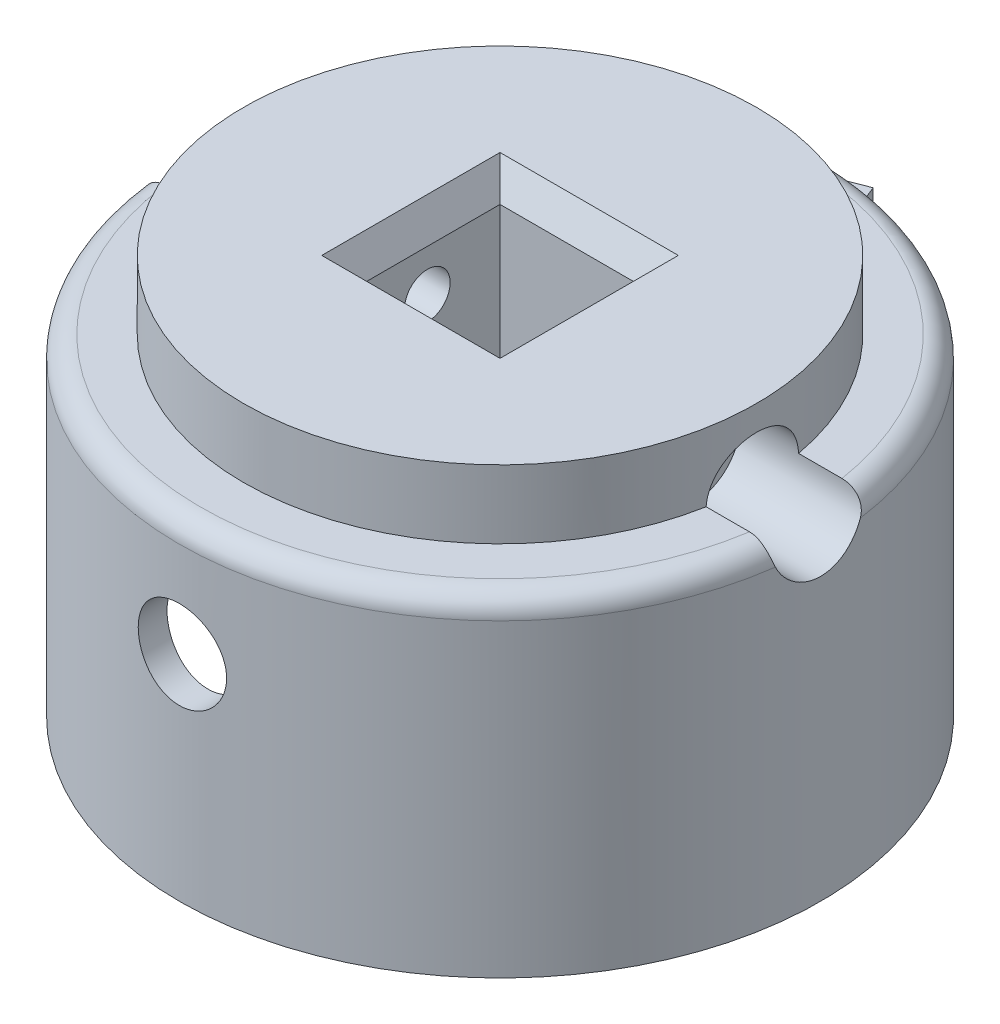
from build123d import *
from OCP.BRepFilletAPI import BRepFilletAPI_MakeChamfer

# Parameters (mm, degrees)
SKETCH1_R                = 22.5
BOSS_EXTRUDE1_DEPTH      = 28
SKETCH2_W                = 10.2
SKETCH2_H                = 10.2
CUT_EXTRUDE2_DEPTH       = 43.385138905
SHELL3_T                 = -2
SKETCH3_R                = 3.1
CUT_EXTRUDE3_DEPTH       = 47.544709689
CHAMFER1_SIZE            = 2
CHAMFER1_SIZE2           = 1.154700538
BOSS_EXTRUDE8_START      = 23
BOSS_EXTRUDE8_DEPTH      = 23
BOSS_EXTRUDE4_DEPTH      = 20
BOSS_EXTRUDE6_DEPTH      = 26
CUT_EXTRUDE5_DEPTH       = 12
SKETCH13_R               = 3.8
CUT_EXTRUDE6_DEPTH       = 16
SKETCH15_W               = 10
SKETCH15_H               = 3
CUT_EXTRUDE8_DEPTH       = 16
CUT_EXTRUDE9_DEPTH       = 2
BOSS_EXTRUDE10_START     = 7
BOSS_EXTRUDE10_DEPTH     = 7
SKETCH21_OUTSIDE_W       = 61.262
SKETCH21_OUTSIDE_H       = 63.966
SKETCH21_OUTSIDE_R       = 18
CUT_EXTRUDE11_DEPTH      = 4.8
CUT_EXTRUDE12_DEPTH      = 47.700948218
CUT_EXTRUDE12_DEPTH_BACK = 47.700948218
SKETCH22_R               = 1.6
CUT_EXTRUDE13_START      = -8.5
SKETCH24_R               = 3.25
CUT_EXTRUDE13_DEPTH      = 39.200948278
CUT_EXTRUDE14_START      = -8.5
CUT_EXTRUDE14_DEPTH      = 39.200948279
FILLET1_R                = 1.5


with BuildPart() as part:
    # Sketch1 → Boss-Extrude1 (new body)
    with BuildSketch(Plane(origin=(0, 0, 0), x_dir=(1, 0, 0), z_dir=(0, 1, 0))):
        with Locations(Location((0, 0, 0), (0, 0, 270))):
            Circle(SKETCH1_R)
    extrude(amount=BOSS_EXTRUDE1_DEPTH)

    # Sketch2 → Cut-Extrude2 (cut, through all)
    with BuildSketch(Plane.XZ):
        Rectangle(SKETCH2_W, SKETCH2_H)
    extrude(amount=-CUT_EXTRUDE2_DEPTH, mode=Mode.SUBTRACT)

    # Shell3
    shell3_openings = [part.faces().sort_by_distance(p)[0] for p in [
        (0, 0, -21.863603897),
    ]]
    offset(amount=SHELL3_T, openings=shell3_openings, kind=Kind.INTERSECTION)

    # Sketch3 → Cut-Extrude3 (cut, through all)
    with BuildSketch(Plane.XY.offset(7.1)):
        with Locations(Location((0, 15, 0), (0, 0, 270.000000016))):
            Circle(SKETCH3_R)
    extrude(amount=CUT_EXTRUDE3_DEPTH, mode=Mode.SUBTRACT)

    # Chamfer1: one chamfer whose edges measure the first distance from different faces: ONE call of the kernel's chamfer builder (chamfer() names one face for all edges)
    chamfer1_edges_1 = [part.edges().sort_by_distance(p)[0] for p in [
        (5.1, 28, 0),
    ]]
    chamfer1_side_1 = [part.faces().sort_by_distance(p)[0] for p in [
        (5.1, 14, 0),
    ]]
    chamfer1_edges_2 = [part.edges().sort_by_distance(p)[0] for p in [
        (0, 28, -5.1),
    ]]
    chamfer1_side_2 = [part.faces().sort_by_distance(p)[0] for p in [
        (0, 14, -5.1),
    ]]
    chamfer1_edges_3 = [part.edges().sort_by_distance(p)[0] for p in [
        (-5.1, 28, 0),
    ]]
    chamfer1_side_3 = [part.faces().sort_by_distance(p)[0] for p in [
        (-5.1, 14, 0),
    ]]
    chamfer1_edges_4 = [part.edges().sort_by_distance(p)[0] for p in [
        (0, 28, 5.1),
    ]]
    chamfer1_side_4 = [part.faces().sort_by_distance(p)[0] for p in [
        (0, 14, 5.1),
    ]]
    chamfer1 = BRepFilletAPI_MakeChamfer(part.part.solid().wrapped)
    for e in chamfer1_edges_1:
        chamfer1.Add(CHAMFER1_SIZE, CHAMFER1_SIZE2, e.wrapped, chamfer1_side_1[0].wrapped)  # the first distance lies on this face
    for e in chamfer1_edges_2:
        chamfer1.Add(CHAMFER1_SIZE, CHAMFER1_SIZE2, e.wrapped, chamfer1_side_2[0].wrapped)  # the first distance lies on this face
    for e in chamfer1_edges_3:
        chamfer1.Add(CHAMFER1_SIZE, CHAMFER1_SIZE2, e.wrapped, chamfer1_side_3[0].wrapped)  # the first distance lies on this face
    for e in chamfer1_edges_4:
        chamfer1.Add(CHAMFER1_SIZE, CHAMFER1_SIZE2, e.wrapped, chamfer1_side_4[0].wrapped)  # the first distance lies on this face
    add(Compound.cast(chamfer1.Shape()), mode=Mode.REPLACE)

    # Sketch18 → Boss-Extrude8 (add)
    with BuildSketch(Plane.XZ.offset(-26).offset(BOSS_EXTRUDE8_START)):
        with BuildLine():
            Line((-15.72889581, -7.671495069), (-18.425277949, -8.986608509))
            ThreePointArc((-18.425277949, -8.986608509), (-20.471905462, 1.072887103), (-17.384985971, 10.863344917))
            Line((-17.384985971, 10.863344917), (-14.840841683, 9.273587124))
            ThreePointArc((-14.840841683, 9.273587124), (-17.476016858, 0.915879234), (-15.72889581, -7.671495069))
        make_face()
    extrude(amount=-BOSS_EXTRUDE8_DEPTH)

    # Sketch9 → Boss-Extrude4 (add)
    with BuildSketch(Plane.XZ):
        Polygon((2.063720939, -22.405156904), (-16.592183615, -15.197020856), (-17.673404022, -17.995406539), (0.982500531, -25.203542587), align=None)
    extrude(amount=-BOSS_EXTRUDE4_DEPTH)

    # Sketch11 → Boss-Extrude6 (add)
    with BuildSketch(Plane.XZ):
        with BuildLine():
            Line((2.063720939, -22.405156904), (7.1, -7.1))
            Line((7.1, -7.1), (-7.1, -7.1))
            Line((-7.1, -7.1), (-16.592183615, -15.197020856))
            ThreePointArc((-16.592183615, -15.197020856), (-8.109153054, -20.987892623), (2.063720939, -22.405156904))
        make_face()
    extrude(amount=-BOSS_EXTRUDE6_DEPTH)

    # Sketch12 → Cut-Extrude5 (cut)
    with BuildSketch(Plane.XZ):
        with BuildLine():
            Line((3.815443281, -17.081705805), (2.751672557, -20.314484934))
            ThreePointArc((2.751672557, -20.314484934), (-6.944400642, -19.287957376), (-15.069534012, -13.89817055))
            Line((-15.069534012, -13.89817055), (-12.787120795, -11.951226815))
            ThreePointArc((-12.787120795, -11.951226815), (-5.167514201, -16.722412434), (3.815443281, -17.081705805))
        make_face()
    extrude(amount=-CUT_EXTRUDE5_DEPTH, mode=Mode.SUBTRACT)

    # Sketch13 → Cut-Extrude6 (cut)
    with BuildSketch(Plane(origin=(-8.345451745, 0, -21.599474563), x_dir=(-0.9327952276785314, 0, 0.3604068024054997), z_dir=(-0.3604068024054997, 0, -0.9327952276785314))):
        with Locations((0, 10)):
            Circle(SKETCH13_R)
    extrude(amount=-CUT_EXTRUDE6_DEPTH, mode=Mode.SUBTRACT)

    # Sketch15 → Cut-Extrude8 (cut)
    with BuildSketch(Plane(origin=(-8.345451745, 0, -21.599474563), x_dir=(-0.9327952276785314, 0, 0.3604068024054997), z_dir=(-0.3604068024054997, 0, -0.9327952276785314))):
        with Locations((0, 10)):
            Rectangle(SKETCH15_W, SKETCH15_H)
    extrude(amount=-CUT_EXTRUDE8_DEPTH, mode=Mode.SUBTRACT)

    # Sketch17 → Cut-Extrude9 (cut)
    with BuildSketch(Plane.XZ):
        with BuildLine():
            Line((7.1, 7.1), (7.1, -7.1))
            Line((7.1, -7.1), (3.815443281, -17.081705805))
            ThreePointArc((3.815443281, -17.081705805), (-5.167514201, -16.722412434), (-12.787120795, -11.951226815))
            Line((-12.787120795, -11.951226815), (-7.1, -7.1))
            Line((-7.1, -7.1), (-7.1, 7.1))
            Line((-7.1, 7.1), (7.1, 7.1))
        make_face()
    extrude(amount=-CUT_EXTRUDE9_DEPTH, mode=Mode.SUBTRACT)

    # Sketch20 → Boss-Extrude10 (add)
    with BuildSketch(Plane.XZ.offset(-26).offset(BOSS_EXTRUDE10_START)):
        with BuildLine():
            Line((2.751672557, -20.314484934), (7.1, -7.1))
            Line((7.1, -7.1), (7.1, 7.1))
            Line((7.1, 7.1), (-7.1, 7.1))
            Line((-7.1, 7.1), (-7.1, -7.1))
            Line((-7.1, -7.1), (-15.069534012, -13.89817055))
            ThreePointArc((-15.069534012, -13.89817055), (6.944400642, 19.287957376), (2.751672557, -20.314484934))
        make_face()
    extrude(amount=-BOSS_EXTRUDE10_DEPTH)

    # Sketch21 outside → Cut-Extrude11 (cut)
    with BuildSketch(Plane(origin=(0, 28, 0), x_dir=(1, 0, 0), z_dir=(0, 1, 0))):
        with Locations((0, 1.352)):
            Rectangle(SKETCH21_OUTSIDE_W, SKETCH21_OUTSIDE_H)
        with Locations(Location((0, 0, 0), (0, 0, 270))):
            Circle(SKETCH21_OUTSIDE_R, mode=Mode.SUBTRACT)
    extrude(amount=-CUT_EXTRUDE11_DEPTH, mode=Mode.SUBTRACT)

    # Sketch22 → Cut-Extrude12 (cut, two sides: drawn at the far end of the back side and taken through both)
    with BuildSketch(Plane.ZY.offset(-5.1).offset(-CUT_EXTRUDE12_DEPTH_BACK)):
        with Locations((0, 23)):
            Circle(SKETCH22_R)
    extrude(amount=CUT_EXTRUDE12_DEPTH + CUT_EXTRUDE12_DEPTH_BACK, mode=Mode.SUBTRACT)

    # Sketch24 → Cut-Extrude13 (cut, through all)
    with BuildSketch(Plane.ZY.offset(-5.1).offset(CUT_EXTRUDE13_START)):
        with Locations((0, 23)):
            Circle(SKETCH24_R)
    extrude(amount=-CUT_EXTRUDE13_DEPTH, mode=Mode.SUBTRACT)

    # Sketch25 → Cut-Extrude14 (cut, through all)
    with BuildSketch(Plane(origin=(-5.1, 0, 0), x_dir=(0, 0, -1), z_dir=(1, 0, 0)).offset(CUT_EXTRUDE14_START)):
        Polygon((0, 19.893553151), (2.690261887, 21.446776575), (2.690261887, 24.553223425), (0, 26.106446849), (-2.690261887, 24.553223425), (-2.690261887, 21.446776575), align=None)
    extrude(amount=-CUT_EXTRUDE14_DEPTH, mode=Mode.SUBTRACT)

    # Fillet1
    # the kernel refuses this fillet: 1.5 mm, written as the material it takes off along each edge
    with BuildSketch(Plane(origin=(0, 23.2, 0), x_dir=(0, 0, 1), z_dir=(1, 0, 0))) as fillet1_piece_1:
        with BuildLine():
            CenterArc((22.5 - FILLET1_R, FILLET1_R), FILLET1_R, 270, 90)
            Line((22.5, FILLET1_R), (22.5, 0))
            Line((22.5, 0), (22.5 - FILLET1_R, 0))
        make_face()
    revolve(axis=Axis((0, 23.2, 0), (0, -1, 0)), revolution_arc=92.685444587, mode=Mode.SUBTRACT)
    with BuildSketch(Plane(origin=(0, 23.2, 0), x_dir=(-0.9988939416216193, 0, 0.04702013814978787), z_dir=(0.04702013814978787, 0, 0.9988939416216193))) as fillet1_piece_2:
        with BuildLine():
            CenterArc((22.5 - FILLET1_R, FILLET1_R), FILLET1_R, 270, 90)
            Line((22.5, FILLET1_R), (22.5, 0))
            Line((22.5, 0), (22.5 - FILLET1_R, 0))
        make_face()
    revolve(axis=Axis((0, 23.2, 0), (0, -1, 0)), revolution_arc=183.967965071, mode=Mode.SUBTRACT)
    with BuildSketch(Plane(origin=(0, 23.2, 0), x_dir=(0.9997569746526436, 0, -0.022045217925738058), z_dir=(-0.022045217925738058, 0, -0.9997569746526436))) as fillet1_piece_3:
        with BuildLine():
            CenterArc((22.5 - FILLET1_R, FILLET1_R), FILLET1_R, 270, 90)
            Line((22.5, FILLET1_R), (22.5, 0))
            Line((22.5, 0), (22.5 - FILLET1_R, 0))
        make_face()
    revolve(axis=Axis((0, 23.2, 0), (0, -1, 0)), revolution_arc=91.263200277, mode=Mode.SUBTRACT)


solid = part.part
